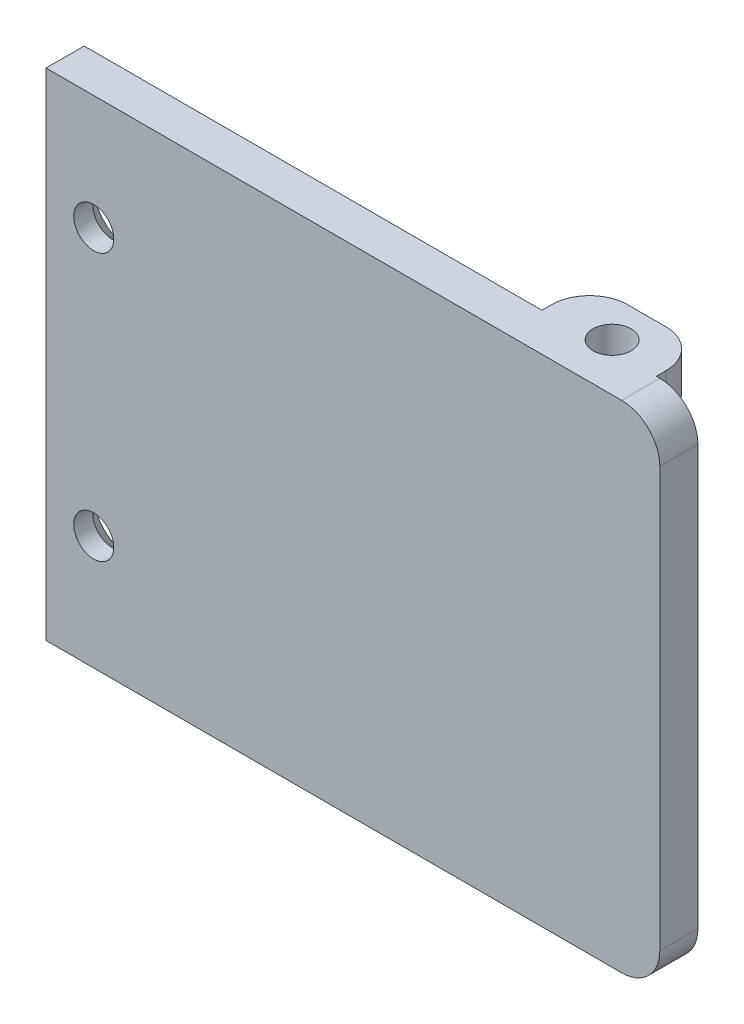
from build123d import *

# Parameters (mm, degrees)
SKETCH_2_W          = 32.183544672
SKETCH_2_H          = 26
EXTRUDE_1_DEPTH     = 2
FILLET_1_R          = 2
CUT_EXTRUDE_2_REACH = 38.671
SKETCH_4_R          = 1.05
CHAMFER_1_SIZE      = 1
SKETCH_5_W          = 6
SKETCH_5_H          = 2
EXTRUDE_2_DEPTH     = 2.5
FILLET_2_R          = 2
SKETCH_6_R          = 1
CUT_EXTRUDE_3_DEPTH = 4
CUT_EXTRUDE_3_DRAFT = -2
SKETCH_7_R          = 1
CUT_EXTRUDE_4_DEPTH = 4
CUT_EXTRUDE_4_DRAFT = -2


with BuildPart() as part:
    # 草图2 → 凸台-拉伸1 (new body)
    with BuildSketch(Plane.XY):
        with Locations((-0.901029093, -19.434236018)):
            Rectangle(SKETCH_2_W, SKETCH_2_H)
    extrude(amount=EXTRUDE_1_DEPTH)

    # 圆角1
    fillet_1_edges = [part.edges().sort_by_distance(p)[0] for p in [
        (15.190743243, -32.434236018, 1),
        (15.190743243, -6.434236018, 1),
    ]]
    fillet(fillet_1_edges, radius=FILLET_1_R)

    # 草图4 → 切除-拉伸2 (cut, up to next)
    with BuildSketch(Plane(origin=(0, 0, 0), x_dir=(-1, 0, 0), z_dir=(0, 0, -1)), mode=Mode.PRIVATE) as cut_extrude_2_sk1:
        with Locations((14.492801429, -12.434236018)):
            Circle(SKETCH_4_R)
    cut_extrude_2_tool1 = extrude(cut_extrude_2_sk1.sketch, amount=-CUT_EXTRUDE_2_REACH, mode=Mode.PRIVATE) & part.part
    # 草图4 → 切除-拉伸2 (cut, up to next)
    with BuildSketch(Plane(origin=(0, 0, 0), x_dir=(-1, 0, 0), z_dir=(0, 0, -1)), mode=Mode.PRIVATE) as cut_extrude_2_sk2:
        with Locations((14.492801429, -26.434236018)):
            Circle(SKETCH_4_R)
    cut_extrude_2_tool2 = extrude(cut_extrude_2_sk2.sketch, amount=-CUT_EXTRUDE_2_REACH, mode=Mode.PRIVATE) & part.part
    add(cut_extrude_2_tool1.solids().sort_by_distance((-14.492801, -12.434236, 0))[0], mode=Mode.SUBTRACT)
    add(cut_extrude_2_tool2.solids().sort_by_distance((-14.492801, -26.434236, 0))[0], mode=Mode.SUBTRACT)

    # 倒角1
    chamfer_1_edges = [part.edges().sort_by_distance(p)[0] for p in [
        (-13.442801429, -12.434236018, 0),
        (-13.442801429, -26.434236018, 0),
    ]]
    chamfer(chamfer_1_edges, length=CHAMFER_1_SIZE)

    # 草图5 → 凸台-拉伸2 (add)
    with BuildSketch(Plane(origin=(0, 0, 0), x_dir=(-1, 0, 0), z_dir=(0, 0, -1))):
        with Locations((-10.007198571, -7.434236018)):
            Rectangle(SKETCH_5_W, SKETCH_5_H)
        with Locations((-10.007198571, -31.434236018)):
            Rectangle(SKETCH_5_W, SKETCH_5_H)
    extrude(amount=EXTRUDE_2_DEPTH)

    # 圆角2
    fillet_2_edges = [part.edges().sort_by_distance(p)[0] for p in [
        (7.007198571, -7.434236018, -2.5),
        (13.007198571, -7.434236018, -2.5),
        (7.007198571, -31.434236018, -2.5),
        (13.007198571, -31.434236018, -2.5),
    ]]
    fillet(fillet_2_edges, radius=FILLET_2_R)


with BuildPart() as cut_extrude_3_tool:
    # 草图6 → 切除-拉伸3 (with draft: the straight prism first)
    with BuildSketch(Plane.XZ.offset(32.434236018)):
        with Locations((10.190743244, -0.5)):
            Circle(SKETCH_6_R)
    extrude(amount=-CUT_EXTRUDE_3_DEPTH)
    # 切除-拉伸3: the draft: its side faces are tilted about the plane it starts from
    cut_extrude_3_sides = [cut_extrude_3_tool.faces().sort_by_distance(p)[0] for p in [
        (9.190743243, -30.434236018, -0.5),
    ]]
    draft(cut_extrude_3_sides, Plane.XZ.offset(32.434236018), CUT_EXTRUDE_3_DRAFT)


with BuildPart() as part_1:
    add(part.part)

    # 切除-拉伸3: cut by cut_extrude_3_tool
    add(cut_extrude_3_tool.part, mode=Mode.SUBTRACT)


with BuildPart() as cut_extrude_4_tool:
    # 草图7 → 切除-拉伸4 (with draft: the straight prism first)
    with BuildSketch(Plane(origin=(0, -6.434236018, 0), x_dir=(1, 0, 0), z_dir=(0, 1, 0))):
        with Locations((10.190743243, 0.5)):
            Circle(SKETCH_7_R)
    extrude(amount=-CUT_EXTRUDE_4_DEPTH)
    # 切除-拉伸4: the draft: its side faces are tilted about the plane it starts from
    cut_extrude_4_sides = [cut_extrude_4_tool.faces().sort_by_distance(p)[0] for p in [
        (9.190743243, -8.434236018, -0.5),
    ]]
    draft(cut_extrude_4_sides, Plane(origin=(0, -6.434236018, 0), x_dir=(1, 0, 0), z_dir=(0, 1, 0)), CUT_EXTRUDE_4_DRAFT)


with BuildPart() as part_2:
    add(part_1.part)

    # 切除-拉伸4: cut by cut_extrude_4_tool
    add(cut_extrude_4_tool.part, mode=Mode.SUBTRACT)


solid = part_2.part
